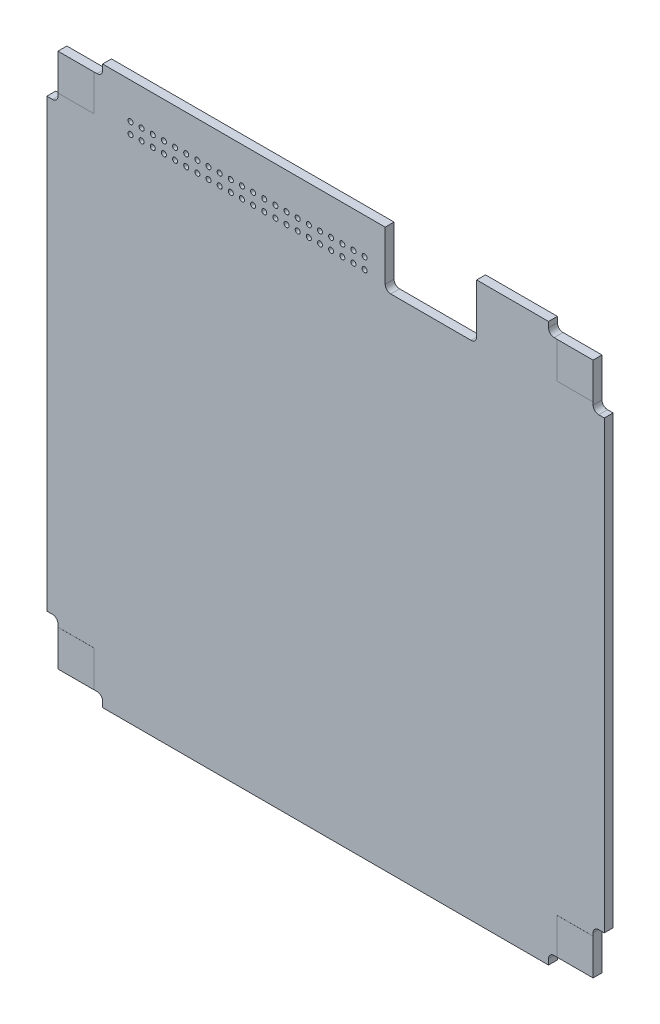
from build123d import *

# Parameters (mm, degrees)
BOSS_EXTRUDE1_DEPTH = 1.5875
FILLET1_R           = 1
SKETCH2_R           = 0.45
CUT_EXTRUDE1_DEPTH  = 71.728496069
CUT_EXTRUDE2_DEPTH  = 9.8806
FILLET2_R           = 1
SKETCH4_W           = 6.5
SKETCH4_H           = 6.5
BOSS_EXTRUDE2_DEPTH = 0.01


with BuildPart() as part:
    # Sketch1 → Boss-Extrude1 (new body)
    with BuildSketch(Plane.XY):
        Polygon((40, 50), (-40, 50), (-40, 48), (-48, 48), (-48, 40), (-50, 40), (-50, -37.864895224), (-50, -40), (-48, -40), (-48, -48), (-40, -48), (-40, -50), (-37.864895224, -50), (40, -50), (40, -48), (48, -48), (48, -40), (50, -40), (50, 40), (48, 40), (48, 48), (40, 48), align=None)
    extrude(amount=BOSS_EXTRUDE1_DEPTH)

    # Fillet1
    fillet1_edges = [part.edges().sort_by_distance(p)[0] for p in [
        (-48, -40, 0.79375),
        (-40, -48, 0.79375),
        (40, -48, 0.79375),
        (48, -40, 0.79375),
        (48, 40, 0.79375),
        (40, 48, 0.79375),
        (-40, 48, 0.79375),
        (-48, 40, 0.79375),
    ]]
    fillet(fillet1_edges, radius=FILLET1_R)

    # Sketch2 → Cut-Extrude1 (cut, through all)
    with BuildSketch(Plane.XY.offset(1.5875)):
        with Locations((-35, 43.55)):
            Circle(SKETCH2_R)
        with Locations((-33, 43.55)):
            Circle(SKETCH2_R)
        with Locations((-31, 43.55)):
            Circle(SKETCH2_R)
        with Locations((-29, 43.55)):
            Circle(SKETCH2_R)
        with Locations((-27, 43.55)):
            Circle(SKETCH2_R)
        with Locations((-25, 43.55)):
            Circle(SKETCH2_R)
        with Locations((-23, 43.55)):
            Circle(SKETCH2_R)
        with Locations((-21, 43.55)):
            Circle(SKETCH2_R)
        with Locations((-19, 43.55)):
            Circle(SKETCH2_R)
        with Locations((-17, 43.55)):
            Circle(SKETCH2_R)
        with Locations((-15, 43.55)):
            Circle(SKETCH2_R)
        with Locations((-13, 43.55)):
            Circle(SKETCH2_R)
        with Locations((-11, 43.55)):
            Circle(SKETCH2_R)
        with Locations((-9, 43.55)):
            Circle(SKETCH2_R)
        with Locations((-7, 43.55)):
            Circle(SKETCH2_R)
        with Locations((-5, 43.55)):
            Circle(SKETCH2_R)
        with Locations((-3, 43.55)):
            Circle(SKETCH2_R)
        with Locations((-1, 43.55)):
            Circle(SKETCH2_R)
        with Locations((1, 43.55)):
            Circle(SKETCH2_R)
        with Locations((3, 43.55)):
            Circle(SKETCH2_R)
        with Locations((5, 43.55)):
            Circle(SKETCH2_R)
        with Locations((7, 43.55)):
            Circle(SKETCH2_R)
        with Locations((-33, 41.55)):
            Circle(SKETCH2_R)
        with Locations((-31, 41.55)):
            Circle(SKETCH2_R)
        with Locations((-29, 41.55)):
            Circle(SKETCH2_R)
        with Locations((-27, 41.55)):
            Circle(SKETCH2_R)
        with Locations((-25, 41.55)):
            Circle(SKETCH2_R)
        with Locations((-23, 41.55)):
            Circle(SKETCH2_R)
        with Locations((-21, 41.55)):
            Circle(SKETCH2_R)
        with Locations((-19, 41.55)):
            Circle(SKETCH2_R)
        with Locations((-17, 41.55)):
            Circle(SKETCH2_R)
        with Locations((-15, 41.55)):
            Circle(SKETCH2_R)
        with Locations((-13, 41.55)):
            Circle(SKETCH2_R)
        with Locations((-11, 41.55)):
            Circle(SKETCH2_R)
        with Locations((-9, 41.55)):
            Circle(SKETCH2_R)
        with Locations((-7, 41.55)):
            Circle(SKETCH2_R)
        with Locations((-5, 41.55)):
            Circle(SKETCH2_R)
        with Locations((-3, 41.55)):
            Circle(SKETCH2_R)
        with Locations((-1, 41.55)):
            Circle(SKETCH2_R)
        with Locations((1, 41.55)):
            Circle(SKETCH2_R)
        with Locations((3, 41.55)):
            Circle(SKETCH2_R)
        with Locations((5, 41.55)):
            Circle(SKETCH2_R)
        with Locations((7, 41.55)):
            Circle(SKETCH2_R)
        with Locations((-35, 41.55)):
            Circle(SKETCH2_R)
    extrude(amount=-CUT_EXTRUDE1_DEPTH, mode=Mode.SUBTRACT)

    # Sketch3 → Cut-Extrude2 (cut)
    with BuildSketch(Plane(origin=(0, 50, 0), x_dir=(1, 0, 0), z_dir=(0, 1, 0))):
        Polygon((10.7, 0), (19.7, 0), (27.1, 0), (27.1, -1.5875), (19.7, -1.5875), (10.7, -1.5875), align=None)
    extrude(amount=-CUT_EXTRUDE2_DEPTH, mode=Mode.SUBTRACT)

    # Fillet2
    fillet2_edges = [part.edges().sort_by_distance(p)[0] for p in [
        (10.7, 40.1194, 0.79375),
        (27.1, 40.1194, 0.79375),
    ]]
    fillet(fillet2_edges, radius=FILLET2_R)

    # Sketch4 → Boss-Extrude2 (add)
    with BuildSketch(Plane.XY.offset(1.5875)):
        with Locations((-44.75, 44.75)):
            Rectangle(SKETCH4_W, SKETCH4_H)
        with Locations((-44.75, -44.75)):
            Rectangle(SKETCH4_W, SKETCH4_H)
        with Locations((44.75, -44.75)):
            Rectangle(SKETCH4_W, SKETCH4_H)
        with Locations((44.75, 44.75)):
            Rectangle(SKETCH4_W, SKETCH4_H)
    extrude(amount=BOSS_EXTRUDE2_DEPTH)


solid = part.part
